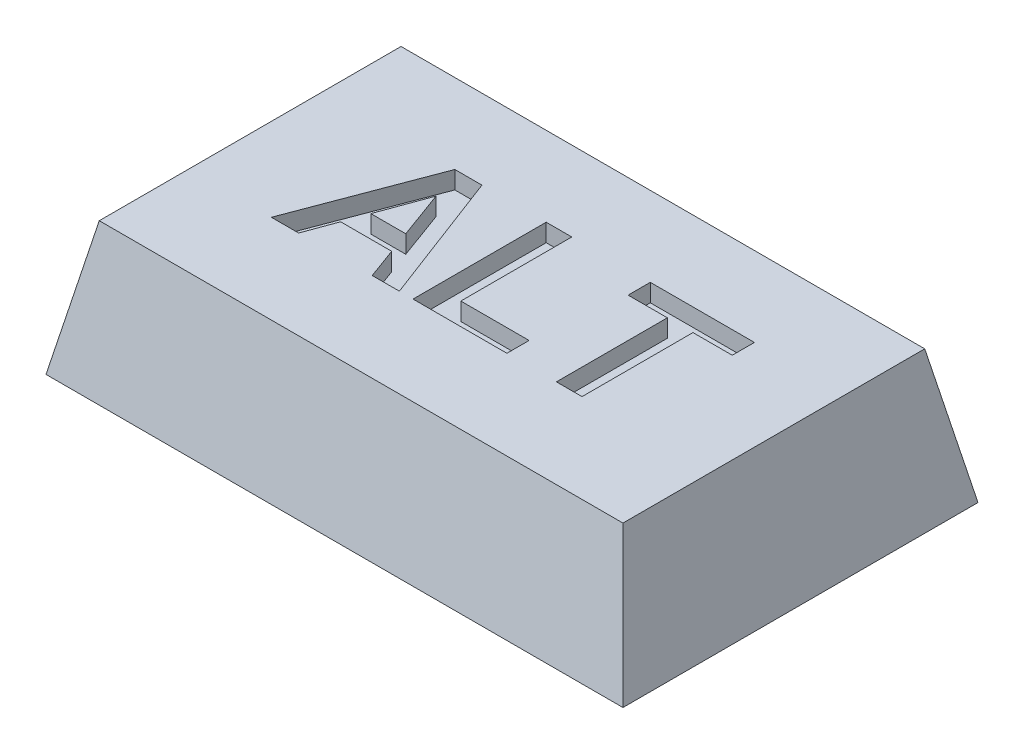
from build123d import *

# Parameters (mm, degrees)
SKETCH1_W               = 13
SKETCH1_H               = 8
BOSS_EXTRUDE1_DEPTH     = 3
CUT_EXTRUDE1_DEPTH      = 16.556349186
CUT_EXTRUDE1_DEPTH_BACK = 16.556349186
CUT_EXTRUDE2_DEPTH      = 16.556349186
CUT_EXTRUDE2_DEPTH_BACK = 16.556349186
SKETCH4_R               = 1.8
CUT_EXTRUDE3_DEPTH      = 0.8
SKETCH5_W               = 8
SKETCH5_H               = 1
BOSS_EXTRUDE2_DEPTH     = 2
FILLET1_R               = 4
CUT_EXTRUDE4_DEPTH      = 0.4


with BuildPart() as part:
    # Sketch1 → Boss-Extrude1 (new body)
    with BuildSketch(Plane(origin=(0, 0, 0), x_dir=(1, 0, 0), z_dir=(0, 1, 0))):
        with Locations((6.5, 4)):
            Rectangle(SKETCH1_W, SKETCH1_H)
    extrude(amount=BOSS_EXTRUDE1_DEPTH)

    # Sketch2 → Cut-Extrude1 (cut, two sides: drawn at the far end of the back side and taken through both)
    with BuildSketch(Plane.XY.offset(-CUT_EXTRUDE1_DEPTH_BACK)):
        Polygon((0, 0), (0.6, 3), (0, 3), align=None)
        Polygon((13, 0), (12.4, 3), (13, 3), align=None)
    extrude(amount=CUT_EXTRUDE1_DEPTH + CUT_EXTRUDE1_DEPTH_BACK, mode=Mode.SUBTRACT)

    # Sketch3 → Cut-Extrude2 (cut, two sides: drawn at the far end of the back side and taken through both)
    with BuildSketch(Plane(origin=(0, 0, 0), x_dir=(0, 0, -1), z_dir=(1, 0, 0)).offset(-CUT_EXTRUDE2_DEPTH_BACK)):
        Polygon((0, 0), (0.6, 3), (0, 3), align=None)
        Polygon((8, 3), (7.4, 3), (8, 0), align=None)
    extrude(amount=CUT_EXTRUDE2_DEPTH + CUT_EXTRUDE2_DEPTH_BACK, mode=Mode.SUBTRACT)

    # Sketch4 → Cut-Extrude3 (cut)
    with BuildSketch(Plane.XZ):
        with Locations(Location((6.50000125, -3.75, 0), (0, 0, 270))):
            Circle(SKETCH4_R)
    extrude(amount=-CUT_EXTRUDE3_DEPTH, mode=Mode.SUBTRACT)

    # Sketch5 → Boss-Extrude2 (add)
    with BuildSketch(Plane.XZ):
        with Locations((6.500011, -7.5)):
            Rectangle(SKETCH5_W, SKETCH5_H)
    extrude(amount=BOSS_EXTRUDE2_DEPTH)

    # Fillet1
    # the kernel refuses this fillet: 4 mm, written as the material it takes off along each edge
    with BuildSketch(Plane(origin=(10.500011, -2, -16.660254038), x_dir=(0, 1, 0), z_dir=(0, 0, 1)), Plane(origin=(2.500011, -2, 1.660254038), x_dir=(0, 1, 0), z_dir=(0, 0, -1))) as fillet1_piece_1:
        with BuildLine():
            CenterArc((4, 3.464101615), FILLET1_R, 180, 60)
            Line((0, 3.464101615), (-0.08, 3.464101615))
            Line((-0.08, 3.464101615), (-0.08, 0))
            Line((-0.08, 0), (0, -0.08))
            ThreePointArc((0, -0.08), (1, -0.08), (1.96, -0.069282032))
            Line((1.96, -0.069282032), (2, 0))
        make_face()
    extrude(amount=18.320508076, mode=Mode.SUBTRACT)

    # Sketch6 → Cut-Extrude4 (cut)
    # profile 1 of 3: a face of its own
    with BuildSketch(Plane(origin=(0, 3, 0), x_dir=(1, 0, 0), z_dir=(0, 1, 0))):
        Polygon((5.356583629, 2.605681315), (4.744804782, 2.605681315), (4.491799975, 3.297989008), (3.340357667, 3.297989008), (3.087352859, 2.605681315), (2.471968244, 2.605681315), (3.605982667, 5.605681315), (4.217160552, 5.605681315), align=None)
        Polygon((4.308506705, 3.797989008), (3.914275936, 4.874912084), (3.52124709, 3.797989008), align=None, mode=Mode.SUBTRACT)
    # profile 2 of 3: a face of its own
    with BuildSketch(Plane(origin=(0, 3, 0), x_dir=(1, 0, 0), z_dir=(0, 1, 0))):
        Polygon((5.664275936, 2.605681315), (5.664275936, 5.605681315), (6.241199013, 5.605681315), (6.241199013, 3.105681315), (7.779660552, 3.105681315), (7.779660552, 2.605681315), align=None)
    # profile 3 of 3: a face of its own
    with BuildSketch(Plane(origin=(0, 3, 0), x_dir=(1, 0, 0), z_dir=(0, 1, 0))):
        Polygon((8.895045167, 2.605681315), (8.895045167, 5.105681315), (8.010429782, 5.105681315), (8.010429782, 5.605681315), (10.356583629, 5.605681315), (10.356583629, 5.105681315), (9.471968244, 5.105681315), (9.471968244, 2.605681315), align=None)
    extrude(amount=-CUT_EXTRUDE4_DEPTH, mode=Mode.SUBTRACT)


solid = part.part
